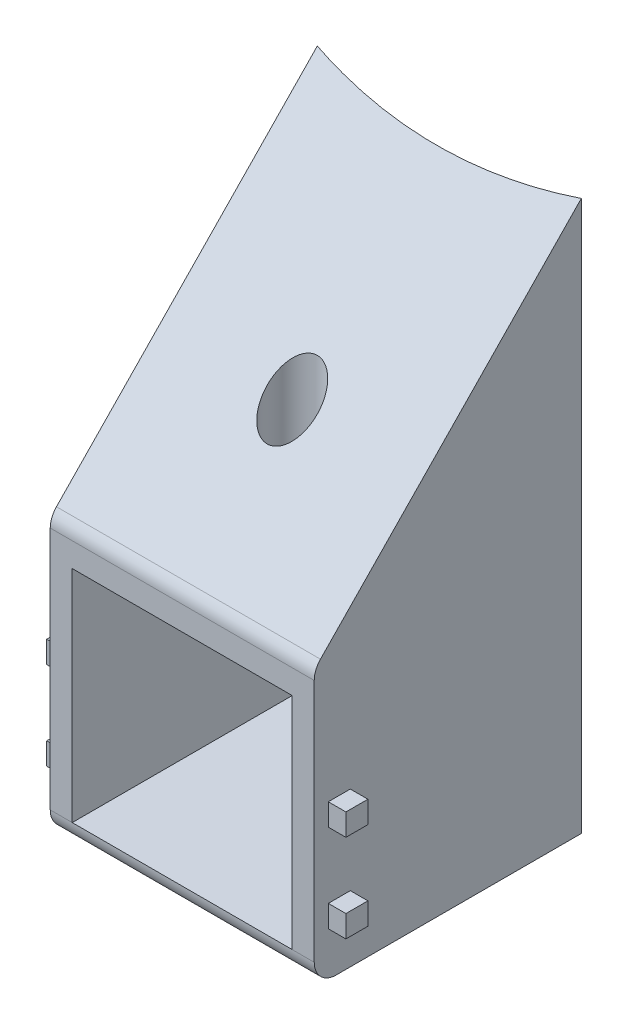
from build123d import *

# Parameters (mm, degrees)
BOSS_EXTRUDE1_DEPTH                 = 31.75
SKETCH3_W                           = 25.4
SKETCH3_H                           = 25.4
CUT_EXTRUDE1_DEPTH                  = 25.4
CUT_EXTRUDE2_DEPTH                  = 30.48
SKETCH5_W                           = 2.54
SKETCH5_H                           = 2.54
BOSS_EXTRUDE2_DEPTH                 = 2.032
SKETCH7_W                           = 2.54
SKETCH7_H                           = 2.54
BOSS_EXTRUDE3_DEPTH                 = 2.032
FILLET1_R                           = 2.54
FILLET2_R                           = 2.54
TAP_DRILL_FOR_6_32_TAP1_D           = 2.7051
TAP_DRILL_FOR_6_32_TAP1_CSINK_D     = 3.9751
TAP_DRILL_FOR_6_32_TAP1_CSINK_ANGLE = 90
TAP_DRILL_FOR_6_32_TAP2_D           = 2.7051
TAP_DRILL_FOR_6_32_TAP2_CSINK_D     = 3.9751
TAP_DRILL_FOR_6_32_TAP2_CSINK_ANGLE = 90


with BuildPart() as part:
    # Sketch1 → Boss-Extrude1 (new, symmetric)
    with BuildSketch(Plane(origin=(0, 0, 0), x_dir=(1, 0, 0), z_dir=(0, 1, 0))):
        with BuildLine():
            Line((-4.43094419, 12.953042159), (-15.24, 12.953042159))
            Line((-15.24, 12.953042159), (-15.24, -16.51))
            Line((-15.24, -16.51), (15.24, -16.51))
            Line((15.24, -16.51), (15.24, 12.953042159))
            Line((15.24, 12.953042159), (4.43094419, 12.953042159))
            ThreePointArc((4.43094419, 12.953042159), (0, 12.82766418), (-4.43094419, 12.953042159))
        make_face()
        with BuildLine():
            Line((-15.24, 14.323960084), (-15.24, 12.953042159))
            Line((-15.24, 12.953042159), (-4.43094419, 12.953042159))
            ThreePointArc((-4.43094419, 12.953042159), (-9.859328847, 13.450401628), (-15.24, 14.323960084))
        make_face()
        with BuildLine():
            ThreePointArc((15.24, 14.323960084), (9.859328847, 13.450401628), (4.43094419, 12.953042159))
            Line((4.43094419, 12.953042159), (15.24, 12.953042159))
            Line((15.24, 12.953042159), (15.24, 14.323960084))
        make_face()
    extrude(amount=BOSS_EXTRUDE1_DEPTH, both=True)

    # Sketch3 → Cut-Extrude1 (cut)
    with BuildSketch(Plane.XY.offset(16.51)):
        with Locations((0, -16.51)):
            Rectangle(SKETCH3_W, SKETCH3_H)
    extrude(amount=-CUT_EXTRUDE1_DEPTH, mode=Mode.SUBTRACT)

    # Sketch4 → Cut-Extrude2 (cut)
    with BuildSketch(Plane(origin=(15.24, 0, 0), x_dir=(0, 0, -1), z_dir=(1, 0, 0))):
        Polygon((-16.51, 31.75), (14.323960084, 31.75), (-16.51, 0), align=None)
    extrude(amount=-CUT_EXTRUDE2_DEPTH, mode=Mode.SUBTRACT)

    # Sketch5 → Boss-Extrude2 (add)
    with BuildSketch(Plane(origin=(15.24, 0, 0), x_dir=(0, 0, -1), z_dir=(1, 0, 0))):
        with Locations((-13.616039916, -25.4)):
            Rectangle(SKETCH5_W, SKETCH5_H)
        with Locations((-13.616039916, -15.24)):
            Rectangle(SKETCH5_W, SKETCH5_H)
    extrude(amount=BOSS_EXTRUDE2_DEPTH)

    # Sketch7 → Boss-Extrude3 (add)
    with BuildSketch(Plane.ZY.offset(15.24)):
        with Locations((13.616039916, -25.4)):
            Rectangle(SKETCH7_W, SKETCH7_H)
        with Locations((13.616039916, -15.24)):
            Rectangle(SKETCH7_W, SKETCH7_H)
    extrude(amount=BOSS_EXTRUDE3_DEPTH)

    # Sketch21 → #1 (0.228) Diameter Hole3 (revolve, cut)
    with BuildSketch(Plane(origin=(0, -3.81, 3.81), x_dir=(0, 0, -1), z_dir=(1, 0, 0))):
        Polygon((0, 0), (0, 35.56), (2.8956, 35.56), (2.8956, 0.12065), (3.01625, 0), align=None)
    revolve(axis=Axis((0, -10.16, 3.81), (0, 1, 0)), mode=Mode.SUBTRACT)

    # Fillet1
    fillet1_edges = [part.edges().sort_by_distance(p)[0] for p in [
        (0, 0, 16.51),
    ]]
    fillet(fillet1_edges, radius=FILLET1_R)

    # Fillet2
    fillet2_edges = [part.edges().sort_by_distance(p)[0] for p in [
        (0, -31.75, 16.51),
    ]]
    fillet(fillet2_edges, radius=FILLET2_R - 0.0001)  # a hair under: the kernel refuses the full size

    # Tap Drill for #6-32 Tap1 (through all)
    with Locations(Plane.XY.offset(-8.89)):
        with Locations((-8.688147052, -16.814161917)):
            CounterSinkHole(TAP_DRILL_FOR_6_32_TAP1_D / 2, TAP_DRILL_FOR_6_32_TAP1_CSINK_D / 2, counter_sink_angle=TAP_DRILL_FOR_6_32_TAP1_CSINK_ANGLE)

    # Tap Drill for #6-32 Tap2 (through all)
    with Locations(Plane.XY.offset(-8.89)):
        with Locations((8.657032922, -16.667582931)):
            CounterSinkHole(TAP_DRILL_FOR_6_32_TAP2_D / 2, TAP_DRILL_FOR_6_32_TAP2_CSINK_D / 2, counter_sink_angle=TAP_DRILL_FOR_6_32_TAP2_CSINK_ANGLE)


solid = part.part
